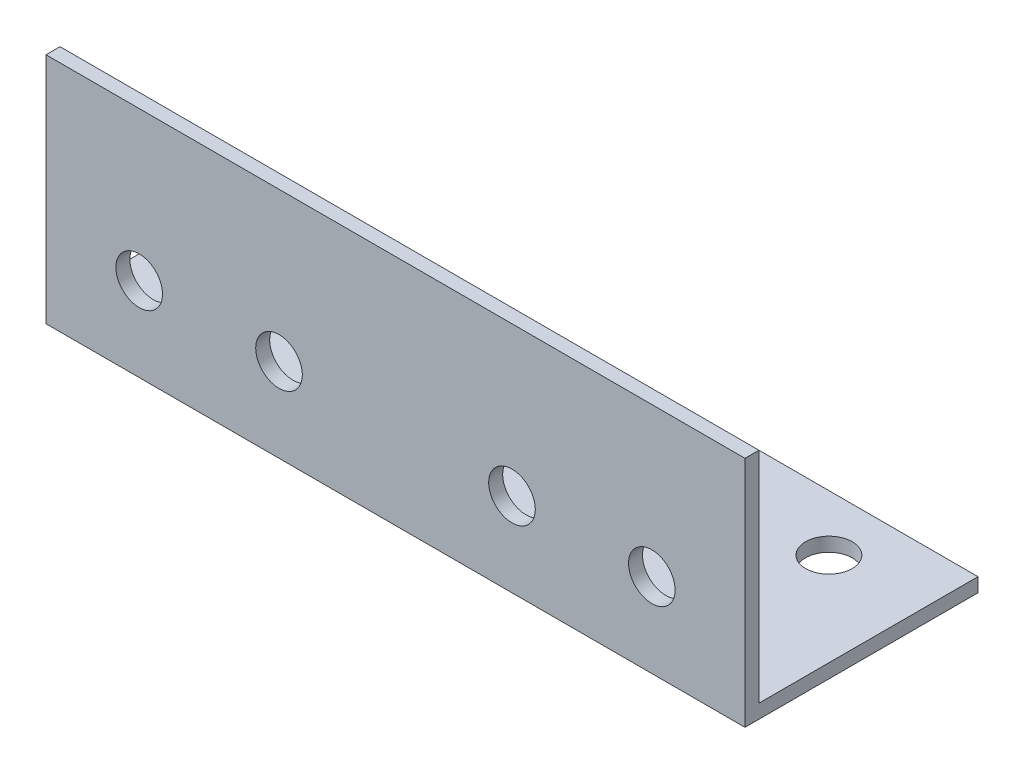
from build123d import *

# Parameters (mm, degrees)
EXTRUDE_1_DEPTH     = 150
SKETCH_2_R          = 5
CUT_EXTRUDE_1_DEPTH = 166.831239518
SKETCH_3_R          = 5
CUT_EXTRUDE_3_DEPTH = 166.831239518


with BuildPart() as part:
    # Эскиз1 → Вытянуть-Тонкостенный1 (new body)
    with BuildSketch(Plane(origin=(0, 0, 0), x_dir=(0, 0, -1), z_dir=(1, 0, 0))):
        Polygon((50, 0), (0, 0), (0, 50), (3, 50), (3, 3), (50, 3), align=None)
    extrude(amount=EXTRUDE_1_DEPTH)

    # Эскиз2 → Вырез-Вытянуть1 (cut, through all)
    with BuildSketch(Plane.XZ):
        with Locations((130, -38)):
            Circle(SKETCH_2_R)
        with Locations((100, -38)):
            Circle(SKETCH_2_R)
        with Locations((50, -38)):
            Circle(SKETCH_2_R)
        with Locations((20, -38)):
            Circle(SKETCH_2_R)
    extrude(amount=-CUT_EXTRUDE_1_DEPTH, mode=Mode.SUBTRACT)

    # Эскиз3 → Вырез-Вытянуть3 (cut, through all)
    with BuildSketch(Plane.XY):
        with Locations((130, 18)):
            Circle(SKETCH_3_R)
        with Locations((100, 18)):
            Circle(SKETCH_3_R)
        with Locations((50, 18)):
            Circle(SKETCH_3_R)
        with Locations((20, 18)):
            Circle(SKETCH_3_R)
    extrude(amount=-CUT_EXTRUDE_3_DEPTH, mode=Mode.SUBTRACT)


solid = part.part
